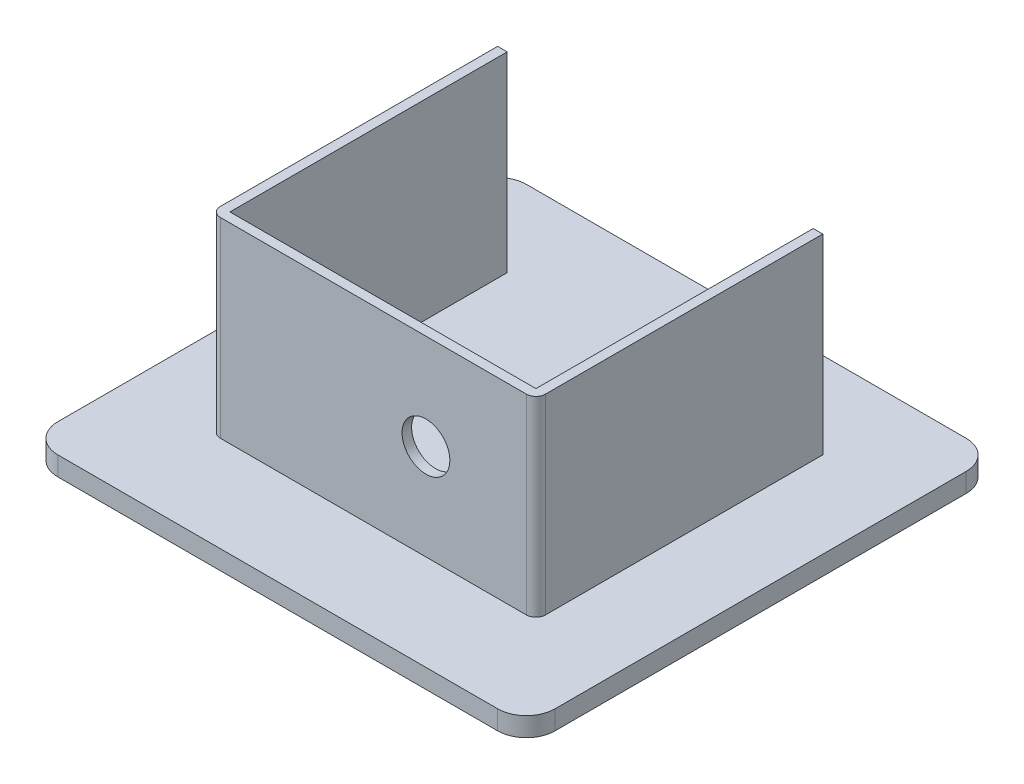
from build123d import *

# Parameters (mm, degrees)
SKETCH3_W            = 52
SKETCH3_H            = 49
BOSS_EXTRUDE3_DEPTH  = 2
SKETCH5_R            = 3.5
SKETCH5_R_2          = 2.5
BOSS_EXTRUDE5_DEPTH  = 3
FILLET1_R            = 3
BOSS_EXTRUDE11_DEPTH = 20
SKETCH12_R           = 2.5
CUT_EXTRUDE2_DEPTH   = 102.434229279
FILLET5_R            = 1


with BuildPart() as part:
    # Sketch3 → Boss-Extrude3 (new body)
    with BuildSketch(Plane(origin=(0, 0, 0), x_dir=(1, 0, 0), z_dir=(0, 1, 0))):
        with Locations((-65.015948434, 26.335900173)):
            Rectangle(SKETCH3_W, SKETCH3_H)
    extrude(amount=BOSS_EXTRUDE3_DEPTH)

    # Sketch5 → Boss-Extrude5 (add)
    with BuildSketch(Plane.XZ):
        with Locations((-62.015948434, -26.335900173)):
            Circle(SKETCH5_R)
        with Locations((-62.015948434, -26.335900173)):
            Circle(SKETCH5_R_2, mode=Mode.SUBTRACT)
    extrude(amount=BOSS_EXTRUDE5_DEPTH)

    # Fillet1
    fillet1_edges = [part.edges().sort_by_distance(p)[0] for p in [
        (-91.015948434, 1, -50.835900173),
        (-91.015948434, 1, -1.835900173),
        (-39.015948434, 1, -50.835900173),
        (-39.015948434, 1, -1.835900173),
    ]]
    fillet(fillet1_edges, radius=FILLET1_R)

    # Sketch11 → Boss-Extrude11 (add)
    with BuildSketch(Plane(origin=(0, 2, 0), x_dir=(1, 0, 0), z_dir=(0, 1, 0))):
        Polygon((-81.015948434, 39.835900173), (-81.015948434, 12.835900173), (-49.015948434, 12.835900173), (-49.015948434, 39.835900173), (-49.015948434, 41.835900173), (-48.015948434, 41.835900173), (-48.015948434, 11.835900173), (-82.015948434, 11.835900173), (-82.015948434, 41.835900173), (-81.015948434, 41.835900173), align=None)
    extrude(amount=BOSS_EXTRUDE11_DEPTH)

    # Sketch12 → Cut-Extrude2 (cut, through all)
    with BuildSketch(Plane.XY.offset(-11.835900173)):
        with Locations((-59.515948434, 12)):
            Circle(SKETCH12_R)
    extrude(amount=-CUT_EXTRUDE2_DEPTH, mode=Mode.SUBTRACT)

    # Fillet5
    fillet5_edges = [part.edges().sort_by_distance(p)[0] for p in [
        (-82.015948434, 12, -11.835900173),
        (-48.015948434, 12, -11.835900173),
    ]]
    fillet(fillet5_edges, radius=FILLET5_R)


solid = part.part
